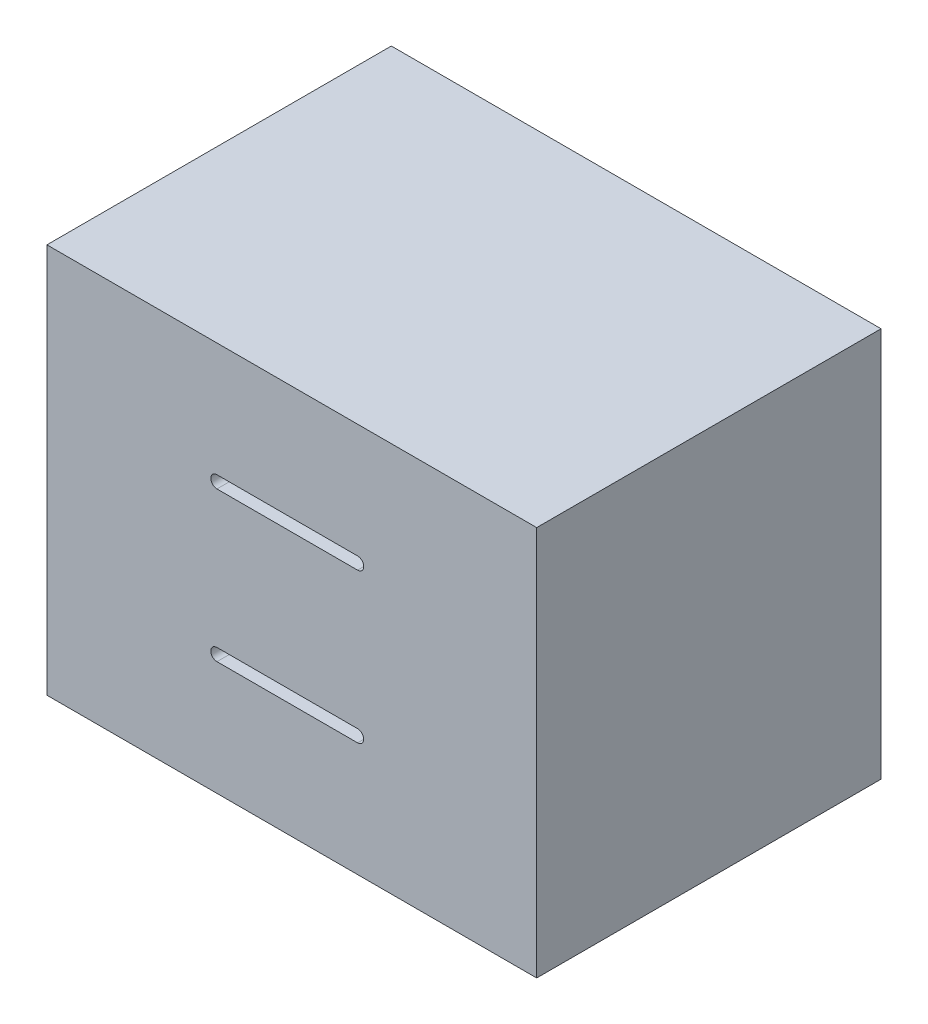
from build123d import *

# Parameters (mm, degrees)
SKETCH1_W           = 53.8
SKETCH1_H           = 37.83
BOSS_EXTRUDE1_DEPTH = 42.85
CUT_EXTRUDE1_DEPTH  = 2


with BuildPart() as part:
    # Sketch1 → Boss-Extrude1 (new body)
    with BuildSketch(Plane(origin=(0, 0, 0), x_dir=(1, 0, 0), z_dir=(0, 1, 0))):
        Rectangle(SKETCH1_W, SKETCH1_H)
    extrude(amount=BOSS_EXTRUDE1_DEPTH)

    # Sketch2 → Cut-Extrude1 (cut)
    with BuildSketch(Plane(origin=(0, 0, -18.915), x_dir=(-1, 0, 0), z_dir=(0, 0, -1))):
        with BuildLine():
            Line((-7.225, 30.315), (8.225, 30.315))
            ThreePointArc((8.225, 30.315), (8.9, 29.64), (8.225, 28.965))
            Line((8.225, 28.965), (-7.225, 28.965))
            ThreePointArc((-7.225, 28.965), (-7.9, 29.64), (-7.225, 30.315))
        make_face()
        with BuildLine():
            Line((-7.225, 13.885), (8.225, 13.885))
            ThreePointArc((8.225, 13.885), (8.9, 13.21), (8.225, 12.535))
            Line((8.225, 12.535), (-7.225, 12.535))
            ThreePointArc((-7.225, 12.535), (-7.9, 13.21), (-7.225, 13.885))
        make_face()
    cut_extrude1 = extrude(amount=-CUT_EXTRUDE1_DEPTH, mode=Mode.SUBTRACT)

    # Mirror1: Cut-Extrude1 across plane
    add(cut_extrude1.mirror(Plane(origin=(0, 0, 0), x_dir=(1, 0, 0), z_dir=(0, 0, -1))), mode=Mode.SUBTRACT)


solid = part.part
